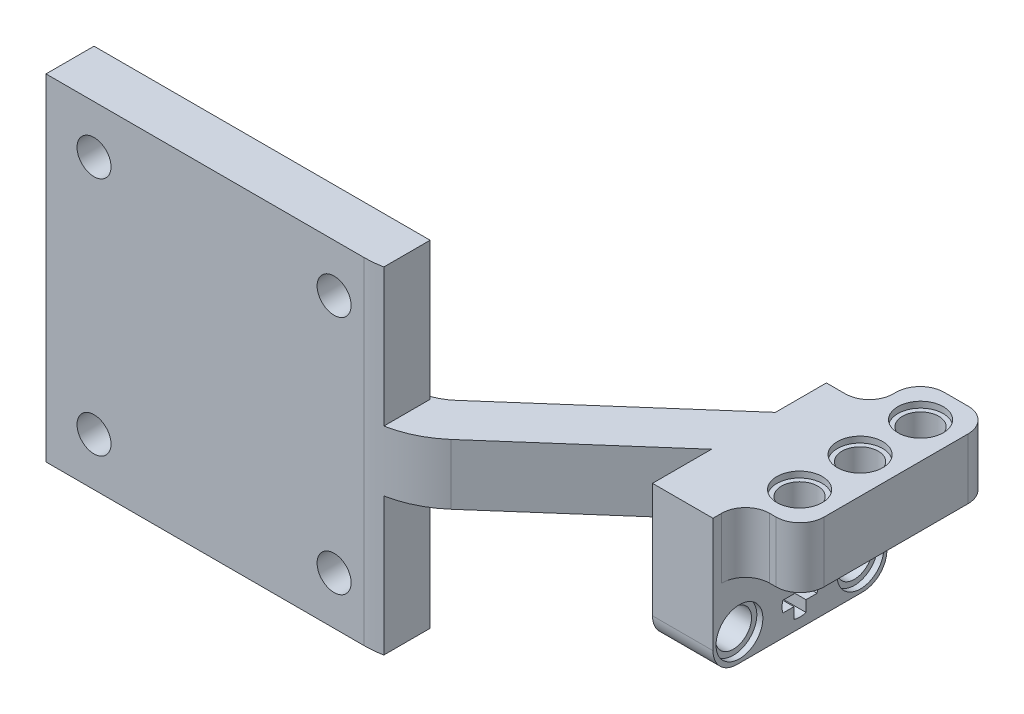
from build123d import *

# Parameters (mm, degrees)
SKETCH6_W                = 9.525
SKETCH6_H                = 25.4
BOSS_EXTRUDE1_DEPTH      = 8
SKETCH16_W               = 8
SKETCH16_H               = 23
BOSS_EXTRUDE6_DEPTH      = 8
SKETCH7_R                = 3
SKETCH7_R_2              = 2.4
CUT_EXTRUDE1_DEPTH       = 0.8
SKETCH7_3_R              = 2.4
CUT_EXTRUDE2_DEPTH       = 7.2
SKETCH9_R                = 3
CUT_EXTRUDE4_DEPTH       = 0.8
BOSS_EXTRUDE3_DEPTH      = 8
FILLET1_R                = 3.175
FILLET3_R                = 3.175
BOSS_EXTRUDE7_DEPTH      = 18.225
BOSS_EXTRUDE7_DEPTH_BACK = 26.225
SKETCH18_W               = 44.45
SKETCH18_H               = 6.35
FILLET6_R                = 12.7
FILLET7_R                = 6.35
SKETCH11_W               = 8
SKETCH11_H               = 23
BOSS_EXTRUDE4_DEPTH      = 6.746167864
SKETCH14_W               = 8
SKETCH14_H               = 23
BOSS_EXTRUDE5_DEPTH      = 3.6
SKETCH13_R               = 3.1
SKETCH13_R_2             = 2.4
CUT_EXTRUDE5_DEPTH       = 0.8
CUT_EXTRUDE6_START       = -8
CUT_EXTRUDE6_OUTLINE_R   = 2.4
CUT_EXTRUDE6_DEPTH       = 8
F_8_CLEARANCE_HOLE1_D    = 4.4958
FILLET8_R                = 3.175


# Read off the part's stored shape, not the designer's step: Cut-Extrude6
with BuildPart() as part:
    # Sketch6 → Boss-Extrude1 (new body)
    with BuildSketch(Plane(origin=(0, 0, 0), x_dir=(1, 0, 0), z_dir=(0, 1, 0))):
        Rectangle(SKETCH6_W, SKETCH6_H)
    extrude(amount=-BOSS_EXTRUDE1_DEPTH)

    # Sketch16 → Boss-Extrude6 (add)
    with BuildSketch(Plane.XZ):
        with Locations((-6.442250006, 5.512369214)):
            Rectangle(SKETCH16_W, SKETCH16_H)
    extrude(amount=BOSS_EXTRUDE6_DEPTH)

    # Sketch7 → Cut-Extrude1 (cut)
    # profile 1 of 3: a face of its own
    with BuildSketch(Plane(origin=(0, 0, 0), x_dir=(1, 0, 0), z_dir=(0, 1, 0))):
        with Locations(Location((0, 8, 0), (0, 0, 270))):
            Circle(SKETCH7_R)
        with Locations(Location((0, 8, 0), (0, 0, 270))):
            Circle(SKETCH7_R_2, mode=Mode.SUBTRACT)
    # profile 2 of 3: a face of its own
    with BuildSketch(Plane(origin=(0, 0, 0), x_dir=(1, 0, 0), z_dir=(0, 1, 0))):
        with Locations(Location((0, 0, 0), (0, 0, 270))):
            Circle(SKETCH7_R)
        with Locations(Location((0, 0, 0), (0, 0, 270))):
            Circle(SKETCH7_R_2, mode=Mode.SUBTRACT)
    # profile 3 of 3: a face of its own
    with BuildSketch(Plane(origin=(0, 0, 0), x_dir=(1, 0, 0), z_dir=(0, 1, 0))):
        with Locations(Location((0, -8, 0), (0, 0, 270))):
            Circle(SKETCH7_R)
        with Locations(Location((0, -8, 0), (0, 0, 270))):
            Circle(SKETCH7_R_2, mode=Mode.SUBTRACT)
    extrude(amount=-CUT_EXTRUDE1_DEPTH, mode=Mode.SUBTRACT)

    # Sketch7<3> → Cut-Extrude2 (cut)
    with BuildSketch(Plane(origin=(0, 0, 0), x_dir=(1, 0, 0), z_dir=(0, 1, 0))):
        with Locations(Location((0, 8, 0), (0, 0, 270))):
            Circle(SKETCH7_3_R)
        with Locations(Location((0, 0, 0), (0, 0, 270))):
            Circle(SKETCH7_3_R)
        with Locations(Location((0, -8, 0), (0, 0, 270))):
            Circle(SKETCH7_3_R)
    extrude(amount=-CUT_EXTRUDE2_DEPTH, mode=Mode.SUBTRACT)

    # Sketch9 → Cut-Extrude4 (cut)
    with BuildSketch(Plane(origin=(0, -7.2, -7.2), x_dir=(1, 0, 0), z_dir=(0, 1, 0))):
        with Locations(Location((0, 0.8, 0), (0, 0, 270))):
            Circle(SKETCH9_R)
        with Locations(Location((0, -7.2, 0), (0, 0, 270))):
            Circle(SKETCH9_R)
        with Locations(Location((0, -15.2, 0), (0, 0, 270))):
            Circle(SKETCH9_R)
    extrude(amount=-CUT_EXTRUDE4_DEPTH, mode=Mode.SUBTRACT)

    # Sketch10 → Boss-Extrude3 (add)
    with BuildSketch(Plane(origin=(0, -8, 0), x_dir=(-1, 0, 0), z_dir=(0, -1, 0))):
        Polygon((4.7625, 4.223850374), (34.7625, -22.098), (60.1625, -22.098), (60.1625, -28.448), (32.37167179, -28.448), (4.7625, -4.223850374), align=None)
    extrude(amount=-BOSS_EXTRUDE3_DEPTH)

    # Fillet1
    fillet1_edges = [part.edges().sort_by_distance(p)[0] for p in [
        (-2.442250006, -4, 12.7),
        (-4.7625, -4, -5.987630786),
    ]]
    fillet(fillet1_edges, radius=FILLET1_R)

    # Fillet3
    fillet3_edges = [part.edges().sort_by_distance(p)[0] for p in [
        (4.7625, -4, 12.7),
        (-4.7625, -4, -12.7),
        (4.7625, -4, -12.7),
    ]]
    fillet(fillet3_edges, radius=FILLET3_R)

    # Sketch18 → Boss-Extrude7 (add, two sides: drawn at the far end of the back side and taken through both)
    with BuildSketch(Plane(origin=(0, 0, 0), x_dir=(1, 0, 0), z_dir=(0, 1, 0)).offset(-BOSS_EXTRUDE7_DEPTH_BACK)):
        with Locations((-56.9875, -25.273)):
            Rectangle(SKETCH18_W, SKETCH18_H)
    extrude(amount=BOSS_EXTRUDE7_DEPTH + BOSS_EXTRUDE7_DEPTH_BACK)

    # Fillet6
    fillet6_edges = [part.edges().sort_by_distance(p)[0] for p in [
        (-32.37167179, -4, 28.448),
    ]]
    fillet(fillet6_edges, radius=FILLET6_R)

    # Fillet7
    fillet7_edges = [part.edges().sort_by_distance(p)[0] for p in [
        (-34.7625, -4, 22.098),
    ]]
    fillet(fillet7_edges, radius=FILLET7_R)

    # Sketch11 → Boss-Extrude4 (add)
    with BuildSketch(Plane(origin=(0, -8, 0), x_dir=(-1, 0, 0), z_dir=(0, -1, 0))):
        with Locations((6.44225, -5.512369144)):
            Rectangle(SKETCH11_W, SKETCH11_H)
    extrude(amount=BOSS_EXTRUDE4_DEPTH)

    # Sketch14 → Boss-Extrude5 (add)
    with BuildSketch(Plane(origin=(0, -14.746167864, 0), x_dir=(-1, 0, 0), z_dir=(0, -1, 0))):
        with Locations((6.44225, -5.512369144)):
            Rectangle(SKETCH14_W, SKETCH14_H)
    extrude(amount=BOSS_EXTRUDE5_DEPTH)

    # Sketch13 → Cut-Extrude5 (cut)
    # profile 1 of 3: a face of its own
    with BuildSketch(Plane(origin=(-2.442250006, 0, 0), x_dir=(0, 0, -1), z_dir=(1, 0, 0))):
        with Locations((-13.512369144, -14.746167864)):
            Circle(SKETCH13_R)
        with Locations((-13.512369144, -14.746167864)):
            Circle(SKETCH13_R_2, mode=Mode.SUBTRACT)
    # profile 2 of 3: a face of its own
    with BuildSketch(Plane(origin=(-2.442250006, 0, 0), x_dir=(0, 0, -1), z_dir=(1, 0, 0))):
        with Locations((2.487630856, -14.746167864)):
            Circle(SKETCH13_R)
        with Locations((2.487630856, -14.746167864)):
            Circle(SKETCH13_R_2, mode=Mode.SUBTRACT)
    # profile 3 of 3: a face of its own
    with BuildSketch(Plane(origin=(-2.442250006, 0, 0), x_dir=(0, 0, -1), z_dir=(1, 0, 0))):
        with BuildLine():
            Line((-6.312369144, -14.014797014), (-6.312369144, -12.552055314))
            ThreePointArc((-6.312369144, -12.552055314), (-5.512369144, -12.425918689), (-4.712369144, -12.552055314))
            Line((-4.712369144, -12.552055314), (-4.712369144, -14.014797014))
            Line((-4.712369144, -14.014797014), (-3.249627444, -14.014797014))
            ThreePointArc((-3.249627444, -14.014797014), (-3.144641809, -14.746167864), (-3.249627444, -15.477538714))
            Line((-3.249627444, -15.477538714), (-4.712369144, -15.477538714))
            Line((-4.712369144, -15.477538714), (-4.712369144, -16.940280414))
            ThreePointArc((-4.712369144, -16.940280414), (-5.512369144, -17.066417039), (-6.312369144, -16.940280414))
            Line((-6.312369144, -16.940280414), (-6.312369144, -15.477538714))
            Line((-6.312369144, -15.477538714), (-7.775110844, -15.477538714))
            ThreePointArc((-7.775110844, -15.477538714), (-7.880096479, -14.746167864), (-7.775110844, -14.014797014))
            Line((-7.775110844, -14.014797014), (-6.312369144, -14.014797014))
        make_face()
    cut_extrude5 = extrude(amount=-CUT_EXTRUDE5_DEPTH, mode=Mode.SUBTRACT)

    # Cut-Extrude6 outline → Cut-Extrude6 (cut)
    with BuildSketch(Plane(origin=(-2.442250006, 0, 0), x_dir=(0, 0, -1), z_dir=(1, 0, 0)).offset(CUT_EXTRUDE6_START)):
        with BuildLine():
            Line((-4.712369144, -15.477538714), (-3.249627444, -15.477538714))
            ThreePointArc((-3.249627444, -15.477538714), (-3.144641809, -14.746167864), (-3.249627444, -14.014797014))
            Line((-3.249627444, -14.014797014), (-4.712369144, -14.014797014))
            Line((-4.712369144, -14.014797014), (-4.712369144, -12.552055314))
            ThreePointArc((-4.712369144, -12.552055314), (-5.512369144, -12.425918689), (-6.312369144, -12.552055314))
            Line((-6.312369144, -12.552055314), (-6.312369144, -14.014797014))
            Line((-6.312369144, -14.014797014), (-7.775110844, -14.014797014))
            ThreePointArc((-7.775110844, -14.014797014), (-7.880096479, -14.746167864), (-7.775110844, -15.477538714))
            Line((-7.775110844, -15.477538714), (-6.312369144, -15.477538714))
            Line((-6.312369144, -15.477538714), (-6.312369144, -16.940280414))
            ThreePointArc((-6.312369144, -16.940280414), (-5.512369144, -17.066417039), (-4.712369144, -16.940280414))
            Line((-4.712369144, -16.940280414), (-4.712369144, -15.477538714))
        make_face()
        with Locations((-13.512369144, -14.746167864)):
            Circle(CUT_EXTRUDE6_OUTLINE_R)
        with Locations((2.487630856, -14.746167864)):
            Circle(CUT_EXTRUDE6_OUTLINE_R)
    extrude(amount=CUT_EXTRUDE6_DEPTH, mode=Mode.SUBTRACT)

    # Mirror1: Cut-Extrude5 across plane
    add(cut_extrude5.mirror(Plane(origin=(-6.442250006, 0, 0), x_dir=(0, 0, 1), z_dir=(1, 0, 0))), mode=Mode.SUBTRACT)

    # #8 Clearance Hole1 (through all)
    with Locations(Plane(origin=(0, 0, 22.098), x_dir=(-1, 0, 0), z_dir=(0, 0, -1))):
        with Locations((72.8625, 11.875), (41.1125, 11.875), (41.1125, -19.875), (72.8625, -19.875)):
            Hole(F_8_CLEARANCE_HOLE1_D / 2)

    # Fillet8
    fillet8_edges = [part.edges().sort_by_distance(p)[0] for p in [
        (-6.44225, -18.346167864, 17.012369144),
        (-6.44225, -18.346167864, -5.987630856),
    ]]
    fillet(fillet8_edges, radius=FILLET8_R)


solid = part.part
